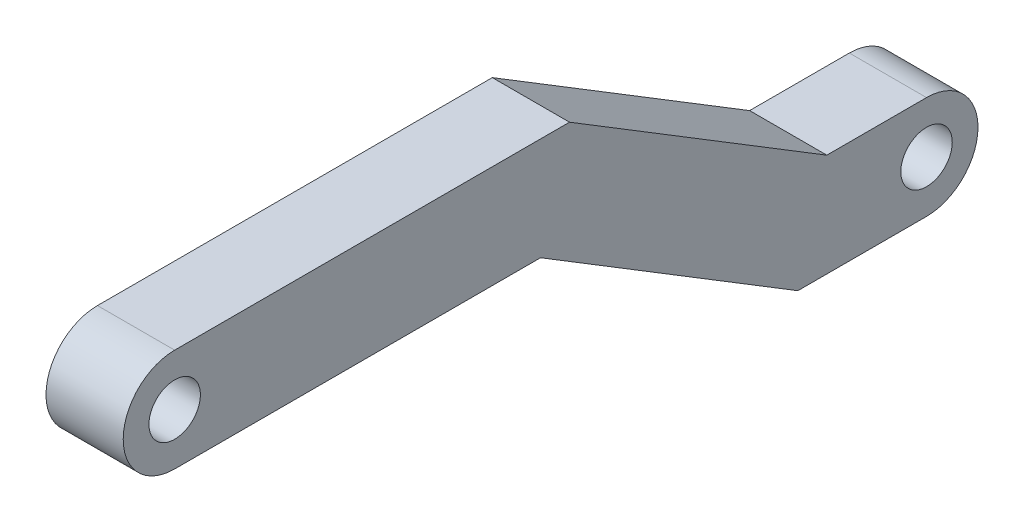
from build123d import *

# Parameters (mm, degrees)
SKETCH2_R           = 1
BOSS_EXTRUDE1_DEPTH = 3


with BuildPart() as part:
    # Sketch2 → Boss-Extrude1 (new body)
    with BuildSketch(Plane(origin=(0, 0, 0), x_dir=(0, 0, -1), z_dir=(1, 0, 0))):
        with BuildLine():
            Line((10, -6.109306765), (13.874820614, -6.109306765))
            ThreePointArc((13.874820614, -6.109306765), (15.874820614, -8.109306765), (13.874820614, -10.109306765))
            Line((13.874820614, -10.109306765), (8.874820614, -10.109306765))
            Line((8.874820614, -10.109306765), (-1.125179386, -4))
            Line((-1.125179386, -4), (-15.34330511, -4))
            ThreePointArc((-15.34330511, -4), (-17.34330511, -2), (-15.34330511, 0))
            Line((-15.34330511, 0), (0, 0))
            Line((0, 0), (10, -6.109306765))
        make_face()
        with Locations((-15.34330511, -2)):
            Circle(SKETCH2_R, mode=Mode.SUBTRACT)
        with Locations((13.874820614, -8.109306765)):
            Circle(SKETCH2_R, mode=Mode.SUBTRACT)
    extrude(amount=BOSS_EXTRUDE1_DEPTH)


solid = part.part
